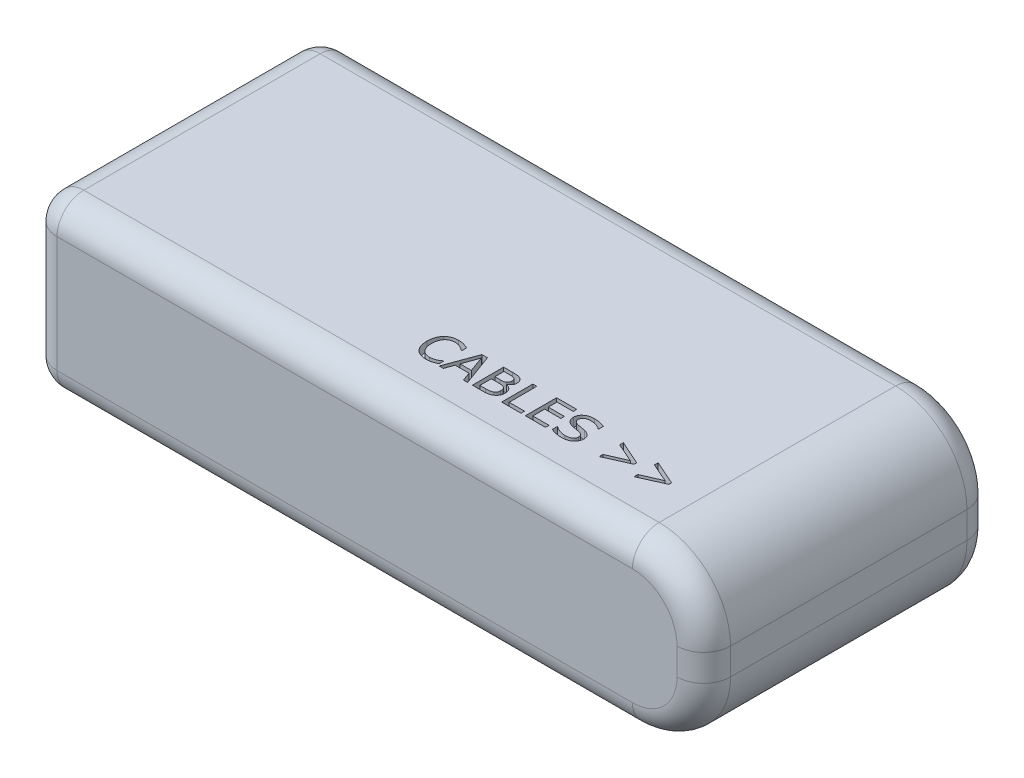
from build123d import *

# Parameters (mm, degrees)
SKETCH1_W           = 75.5
SKETCH1_H           = 32.5
BOSS_EXTRUDE1_DEPTH = 19
FILLET2_R           = 3
FILLET3_R           = 8
CUT_EXTRUDE1_DEPTH  = 1


with BuildPart() as part:
    # Sketch1 → Boss-Extrude1 (new body)
    with BuildSketch(Plane(origin=(0, 0, 0), x_dir=(1, 0, 0), z_dir=(0, 1, 0))):
        with Locations((37.75, 16.25)):
            Rectangle(SKETCH1_W, SKETCH1_H)
    extrude(amount=BOSS_EXTRUDE1_DEPTH)

    # Fillet2
    fillet2_edges = [part.edges().sort_by_distance(p)[0] for p in [
        (37.75, 19, -32.5),
        (0, 19, -16.25),
        (37.75, 0, -32.5),
        (37.75, 0, 0),
        (0, 0, -16.25),
        (37.75, 19, 0),
        (0, 9.5, -32.5),
        (75.5, 9.5, -32.5),
        (75.5, 9.5, 0),
        (0, 9.5, 0),
    ]]
    fillet(fillet2_edges, radius=FILLET2_R)

    # Fillet3
    # the kernel refuses this fillet: 8 mm, written as the material it takes off along each edge
    with BuildSketch(Plane(origin=(67.5, 11, 0), x_dir=(1, 0, 0), z_dir=(0, -1, 0))) as fillet3_piece_1:
        with BuildLine():
            CenterArc((5, -3), 3, 0, 90)
            Line((8, -3), (8, 0))
            Line((8, 0), (5, 0))
        make_face()
    revolve(axis=Axis((67.5, 11, 0), (0, 0, 1)), revolution_arc=90, mode=Mode.SUBTRACT)
    with BuildSketch(Plane(origin=(67.5, 8, 0), x_dir=(0, -1, 0), z_dir=(-1, 0, 0))) as fillet3_piece_2:
        with BuildLine():
            CenterArc((5, -3), 3, 0, 90)
            Line((8, -3), (8, 0))
            Line((8, 0), (5, 0))
        make_face()
    revolve(axis=Axis((67.5, 8, 0), (0, 0, 1)), revolution_arc=90, mode=Mode.SUBTRACT)
    with BuildSketch(Plane(origin=(67.5, 11, -32.5), x_dir=(0, 1, 0), z_dir=(-1, 0, 0))) as fillet3_piece_3:
        with BuildLine():
            CenterArc((5, -3), 3, 0, 90)
            Line((8, -3), (8, 0))
            Line((8, 0), (5, 0))
        make_face()
    revolve(axis=Axis((67.5, 11, -32.5), (0, 0, -1)), revolution_arc=90, mode=Mode.SUBTRACT)
    with BuildSketch(Plane(origin=(67.5, 8, -32.5), x_dir=(1, 0, 0), z_dir=(0, 1, 0))) as fillet3_piece_4:
        with BuildLine():
            CenterArc((5, -3), 3, 0, 90)
            Line((8, -3), (8, 0))
            Line((8, 0), (5, 0))
        make_face()
    revolve(axis=Axis((67.5, 8, -32.5), (0, 0, -1)), revolution_arc=90, mode=Mode.SUBTRACT)
    with BuildSketch(Plane(origin=(75.5, 19, 0), x_dir=(0, -1, 0), z_dir=(0, 0, -1)), Plane(origin=(75.5, 0, 0), x_dir=(-1, 0, 0), z_dir=(0, 0, -1))) as fillet3_piece_5:
        with BuildLine():
            CenterArc((FILLET3_R, FILLET3_R), FILLET3_R, 180, 90)
            Line((0, FILLET3_R), (0, 0))
            Line((0, 0), (FILLET3_R, 0))
        make_face()
    extrude(amount=32.5, mode=Mode.SUBTRACT)

    # Sketch4 → Cut-Extrude1 (cut)
    # profile 1 of 8: a face of its own
    with BuildSketch(Plane(origin=(0, 19, 0), x_dir=(1, 0, 0), z_dir=(0, 1, 0))):
        with BuildLine():
            add(Edge.make_bspline(
                [(39.761180727, 6.076453416), (39.720484477, 6.058874101), (39.64281287, 6.025322764), (39.54759346, 5.981143235), (39.471127875, 5.9477338), (39.407130772, 5.922902791), (39.335102502, 5.897295269), (39.284039435, 5.880867305), (39.257225031, 5.872240599)],
                knots=[0, 0, 0, 0, 1.466218801, 2.79837997, 3.471842409, 4.225859324, 5.068357454, 6, 6, 6, 6], degree=3))
            add(Edge.make_bspline(
                [(39.257225031, 5.872240599), (39.207968746, 5.858393861), (39.105989177, 5.829725755), (38.974333745, 5.800858137), (38.861986653, 5.783462817), (38.772376378, 5.773791359), (38.678344135, 5.768327294), (38.614365421, 5.767462218), (38.58159212, 5.76701908)],
                knots=[0, 0, 0, 0, 1.341692312, 2.777822261, 3.530957039, 4.322171559, 5.140526999, 6, 6, 6, 6], degree=3))
            add(Edge.make_bspline(
                [(38.58159212, 5.76701908), (38.519929285, 5.768355498), (38.399266194, 5.770970627), (38.222513835, 5.791243913), (38.054463539, 5.825312028), (37.894447067, 5.871624311), (37.744302339, 5.934266236), (37.603880435, 6.011629267), (37.473197124, 6.104302318), (37.395857394, 6.177921695), (37.357007468, 6.214902783)],
                knots=[0, 0, 0, 0, 1.104385245, 2.161083527, 3.181659255, 4.173014903, 5.140224961, 6.089300729, 7.040201895, 8, 8, 8, 8], degree=3))
            add(Edge.make_bspline(
                [(37.357007468, 6.214902783), (37.320701449, 6.254464099), (37.247223893, 6.334529855), (37.153765928, 6.472242323), (37.072868704, 6.624760881), (37.015867572, 6.762560162), (36.976624825, 6.879875975), (36.951082305, 6.972791905), (36.9296039, 7.069130487), (36.912500628, 7.168988599), (36.898760705, 7.272209539), (36.887970816, 7.379062773), (36.882854508, 7.489508839), (36.881911143, 7.564318859), (36.881433892, 7.602165441)],
                knots=[0, 0, 0, 0, 1.283960364, 2.59852975, 3.969994339, 5.411216797, 6.162297344, 6.930149855, 7.716785184, 8.524073837, 9.354463407, 10.209115187, 11.093986735, 12, 12, 12, 12], degree=3))
            add(Edge.make_bspline(
                [(36.881433892, 7.602165441), (36.8828038, 7.673304501), (36.885479887, 7.812273172), (36.908976941, 8.014558081), (36.945562961, 8.205706121), (36.999229255, 8.384416385), (37.066019503, 8.551411318), (37.147370594, 8.704875522), (37.241279521, 8.845840716), (37.315387058, 8.928852109), (37.35216174, 8.970045188)],
                knots=[0, 0, 0, 0, 1.151470104, 2.249372842, 3.292771279, 4.298713855, 5.265859146, 6.200122615, 7.106839577, 8, 8, 8, 8], degree=3))
            add(Edge.make_bspline(
                [(37.35216174, 8.970045188), (37.39007419, 9.007254097), (37.465942447, 9.081714468), (37.595846929, 9.176247698), (37.735849528, 9.258585569), (37.887797376, 9.325420417), (38.049262578, 9.378989403), (38.220005394, 9.416541178), (38.399101505, 9.440134264), (38.521291238, 9.442848605), (38.58366886, 9.44423427)],
                knots=[0, 0, 0, 0, 0.93877872, 1.878631025, 2.833735871, 3.807891388, 4.809756893, 5.838894108, 6.896759623, 8, 8, 8, 8], degree=3))
            add(Edge.make_bspline(
                [(38.58366886, 9.44423427), (38.630303909, 9.443409178), (38.723738151, 9.441756089), (38.863674652, 9.429152455), (39.003118048, 9.407156471), (39.144094049, 9.378162647), (39.288899642, 9.338107461), (39.440222249, 9.285653431), (39.599217053, 9.220698182), (39.706056424, 9.169515075), (39.761180727, 9.143106897)],
                knots=[0, 0, 0, 0, 0.912280266, 1.827771541, 2.74586349, 3.672824498, 4.642053622, 5.682771375, 6.804414393, 8, 8, 8, 8], degree=3))
            Line((39.761180727, 9.143106897), (39.761180727, 8.602462118))
            Line((39.761180727, 8.602462118), (39.726568385, 8.602462118))
            add(Edge.make_bspline(
                [(39.726568385, 8.602462118), (39.679577892, 8.639209573), (39.588149769, 8.710708095), (39.445289051, 8.802881474), (39.303658481, 8.880580716), (39.160608333, 8.941340487), (39.016072519, 8.988227761), (38.86739247, 9.021855015), (38.713632844, 9.041204433), (38.609334862, 9.044058817), (38.556671234, 9.045500093)],
                knots=[0, 0, 0, 0, 1.120106368, 2.179360474, 3.189882691, 4.151225788, 5.094345944, 6.040797339, 7.010731367, 8, 8, 8, 8], degree=3))
            add(Edge.make_bspline(
                [(38.556671234, 9.045500093), (38.513938496, 9.044406419), (38.430473339, 9.042270265), (38.308347941, 9.026450522), (38.193024497, 8.99837105), (38.083347617, 8.960617376), (37.980116171, 8.91011576), (37.882557252, 8.848275019), (37.790891729, 8.773488436), (37.735982204, 8.715698616), (37.707976613, 8.686223985)],
                knots=[0, 0, 0, 0, 1.077777966, 2.105105195, 3.098943798, 4.067194587, 5.025139116, 5.990709632, 6.975198523, 8, 8, 8, 8], degree=3))
            add(Edge.make_bspline(
                [(37.707976613, 8.686223985), (37.682085675, 8.654928986), (37.629273988, 8.591094231), (37.562323513, 8.482521087), (37.504513238, 8.362403449), (37.454982385, 8.230982681), (37.416826171, 8.088076367), (37.388323473, 7.934696928), (37.371765162, 7.770515209), (37.369792201, 7.65758301), (37.368775664, 7.599396454)],
                knots=[0, 0, 0, 0, 0.837152518, 1.707602665, 2.623111512, 3.584231206, 4.60047704, 5.670492373, 6.799757481, 8, 8, 8, 8], degree=3))
            add(Edge.make_bspline(
                [(37.368775664, 7.599396454), (37.369861352, 7.538884444), (37.371959594, 7.421936607), (37.391111826, 7.253202502), (37.420760567, 7.097289449), (37.463772151, 6.954794276), (37.517553515, 6.825829949), (37.577751363, 6.709022326), (37.644294638, 6.603658039), (37.696846029, 6.542459992), (37.722513797, 6.512568922)],
                knots=[0, 0, 0, 0, 1.241862862, 2.400071917, 3.481468856, 4.496024571, 5.449649898, 6.345871311, 7.192071002, 8, 8, 8, 8], degree=3))
            add(Edge.make_bspline(
                [(37.722513797, 6.512568922), (37.750023337, 6.484407008), (37.804686358, 6.428447683), (37.897476027, 6.357461433), (37.996539855, 6.297212534), (38.101965291, 6.249031496), (38.21218071, 6.211555905), (38.326121509, 6.185561708), (38.442889547, 6.16900912), (38.521772996, 6.166844075), (38.561516961, 6.165753258)],
                knots=[0, 0, 0, 0, 1.009916827, 2.006762181, 2.990523006, 3.982176514, 4.977241329, 5.97482617, 6.979653641, 8, 8, 8, 8], degree=3))
            add(Edge.make_bspline(
                [(38.561516961, 6.165753258), (38.616040555, 6.167053465), (38.723874742, 6.169624952), (38.882845745, 6.190996545), (39.036732631, 6.225566226), (39.185527427, 6.274277877), (39.329463706, 6.336851864), (39.46831612, 6.413561266), (39.602823315, 6.503498035), (39.686335735, 6.573384883), (39.728645126, 6.608791232)],
                knots=[0, 0, 0, 0, 1.024484406, 2.026176845, 3.008910844, 3.985452258, 4.964427371, 5.954398846, 6.9636495, 8, 8, 8, 8], degree=3))
            Line((39.728645126, 6.608791232), (39.761180727, 6.608791232))
            Line((39.761180727, 6.608791232), (39.761180727, 6.076453416))
        make_face()
    # profile 2 of 8: a face of its own
    with BuildSketch(Plane(origin=(0, 19, 0), x_dir=(1, 0, 0), z_dir=(0, 1, 0))):
        Polygon((43.172573132, 5.855626675), (42.700460791, 5.855626675), (42.35502962, 6.83031022), (40.800243227, 6.83031022), (40.454812056, 5.855626675), (39.982699715, 5.855626675), (41.265433101, 9.355626675), (41.889839746, 9.355626675), align=None)
        Polygon((42.209657784, 7.229044397), (41.577636423, 8.988043606), (40.943538322, 7.229044397), align=None, mode=Mode.SUBTRACT)
    # profile 3 of 8: a face of its own
    with BuildSketch(Plane(origin=(0, 19, 0), x_dir=(1, 0, 0), z_dir=(0, 1, 0))):
        with BuildLine():
            add(Edge.make_bspline(
                [(46.318142753, 6.925840283), (46.31696668, 6.883776158), (46.314680661, 6.802013009), (46.296332012, 6.683073225), (46.266139962, 6.571617523), (46.222968918, 6.468130349), (46.169107701, 6.373419926), (46.108354053, 6.285730355), (46.037518888, 6.207816113), (45.984087109, 6.163098392), (45.957482151, 6.140832372)],
                knots=[0, 0, 0, 0, 1.127205895, 2.191033432, 3.217516844, 4.215822864, 5.187970898, 6.13360162, 7.07067571, 8, 8, 8, 8], degree=3))
            add(Edge.make_bspline(
                [(45.957482151, 6.140832372), (45.924462572, 6.116418159), (45.858836209, 6.067894947), (45.753299758, 6.007020035), (45.642782045, 5.957550466), (45.52611317, 5.917923269), (45.398647511, 5.889664935), (45.257424785, 5.870269324), (45.100475322, 5.857688206), (44.990439515, 5.856334074), (44.932956835, 5.855626675)],
                knots=[0, 0, 0, 0, 0.907236661, 1.803131515, 2.686700274, 3.580326963, 4.521999058, 5.567986659, 6.72951679, 8, 8, 8, 8], degree=3))
            Line((44.932956835, 5.855626675), (43.704218702, 5.855626675))
            Line((43.704218702, 5.855626675), (43.704218702, 9.355626675))
            Line((43.704218702, 9.355626675), (44.724590537, 9.355626675))
            add(Edge.make_bspline(
                [(44.724590537, 9.355626675), (44.755049825, 9.355449093), (44.813894568, 9.355106019), (44.899046495, 9.353748023), (44.978423973, 9.351591975), (45.051838707, 9.349191089), (45.119438954, 9.344820891), (45.180828674, 9.340045009), (45.236518696, 9.33477274), (45.302702433, 9.325468864), (45.381074091, 9.310624447), (45.472353001, 9.284788372), (45.561496711, 9.251079291), (45.618719949, 9.22294786), (45.647355569, 9.208870346)],
                knots=[0, 0, 0, 0, 1.16087609, 2.242713483, 3.245606601, 4.187250078, 5.041924002, 5.827030612, 6.534080644, 7.173345571, 8.373754481, 9.570873092, 10.784417723, 12, 12, 12, 12], degree=3))
            add(Edge.make_bspline(
                [(45.647355569, 9.208870346), (45.677453637, 9.191482023), (45.735554805, 9.157915687), (45.811379384, 9.095041339), (45.874526576, 9.025574854), (45.924483582, 8.94800062), (45.961838612, 8.862995507), (45.989053395, 8.770701766), (46.004879493, 8.670383534), (46.006949113, 8.600903442), (46.00801617, 8.565080789)],
                knots=[0, 0, 0, 0, 1.067729609, 2.061140186, 3.016146581, 3.945508921, 4.886081139, 5.863125532, 6.898266949, 8, 8, 8, 8], degree=3))
            add(Edge.make_bspline(
                [(46.00801617, 8.565080789), (46.006723997, 8.524571963), (46.004219199, 8.446048082), (45.979945084, 8.332996845), (45.940653011, 8.229118235), (45.884131848, 8.135646573), (45.81503362, 8.052073725), (45.735943485, 7.976387923), (45.646187222, 7.909354834), (45.579985516, 7.872767149), (45.546287531, 7.854143289)],
                knots=[0, 0, 0, 0, 1.083450804, 2.10020309, 3.080166319, 4.044478977, 5.010492609, 5.976328372, 6.969910915, 8, 8, 8, 8], degree=3))
            Line((45.546287531, 7.854143289), (45.546287531, 7.835452625))
            add(Edge.make_bspline(
                [(45.546287531, 7.835452625), (45.575465579, 7.828936116), (45.632717204, 7.816149766), (45.715598452, 7.790311034), (45.793625203, 7.759366414), (45.867055753, 7.723076653), (45.935474236, 7.68175119), (45.999111635, 7.634851868), (46.0579267, 7.582941904), (46.111905469, 7.526197703), (46.160560106, 7.465209988), (46.203116712, 7.400013144), (46.238240867, 7.330388424), (46.267711406, 7.257051642), (46.290373997, 7.17984837), (46.306260757, 7.09850375), (46.316079023, 7.013534751), (46.317447052, 6.955402823), (46.318142753, 6.925840283)],
                knots=[0, 0, 0, 0, 1.099394393, 2.157173627, 3.189583421, 4.184138321, 5.166740929, 6.125931184, 7.088121259, 8.048737596, 9.003184014, 9.954341118, 10.907163203, 11.867066763, 12.858138352, 13.861922988, 14.91269755, 16, 16, 16, 16], degree=3))
        make_face()
        with BuildLine():
            add(Edge.make_bspline(
                [(45.520674398, 8.504163068), (45.520127987, 8.524723527), (45.519080223, 8.56414903), (45.511552027, 8.620826459), (45.498546835, 8.672515043), (45.479641564, 8.719534081), (45.455421203, 8.762126315), (45.424819849, 8.800616107), (45.387564673, 8.83443708), (45.358750467, 8.852767425), (45.344151455, 8.862054682)],
                knots=[0, 0, 0, 0, 1.174881232, 2.252881855, 3.260417971, 4.213033844, 5.140488812, 6.050815403, 7.012425702, 8, 8, 8, 8], degree=3))
            add(Edge.make_bspline(
                [(45.344151455, 8.862054682), (45.325227774, 8.872243562), (45.28661199, 8.893035055), (45.222674596, 8.915510349), (45.153305812, 8.932157257), (45.077375734, 8.941821119), (44.994427399, 8.948547271), (44.902762497, 8.953046364), (44.801923899, 8.956948022), (44.731517591, 8.956911521), (44.694823923, 8.956892498)],
                knots=[0, 0, 0, 0, 0.776481191, 1.584492397, 2.442929162, 3.353094416, 4.34992781, 5.45332361, 6.672748265, 8, 8, 8, 8], degree=3))
            Line((44.694823923, 8.956892498), (44.147256677, 8.956892498))
            Line((44.147256677, 8.956892498), (44.147256677, 7.937905156))
            Line((44.147256677, 7.937905156), (44.741204461, 7.937905156))
            add(Edge.make_bspline(
                [(44.741204461, 7.937905156), (44.775359324, 7.9381431), (44.8400053, 7.938593465), (44.931457005, 7.942632119), (45.011836423, 7.949431583), (45.082803048, 7.958605555), (45.147286755, 7.973592629), (45.207783569, 7.994262379), (45.266335132, 8.020789085), (45.302827821, 8.042970304), (45.32130731, 8.054202625)],
                knots=[0, 0, 0, 0, 1.364369286, 2.582384429, 3.655623187, 4.58639984, 5.438292603, 6.295306664, 7.136762368, 8, 8, 8, 8], degree=3))
            add(Edge.make_bspline(
                [(45.32130731, 8.054202625), (45.338577182, 8.066377617), (45.37228117, 8.090138406), (45.415037599, 8.134100664), (45.450370565, 8.182853828), (45.476345468, 8.237890214), (45.496494279, 8.29740777), (45.510962724, 8.361894208), (45.519164002, 8.43149417), (45.520160767, 8.479451029), (45.520674398, 8.504163068)],
                knots=[0, 0, 0, 0, 0.982653958, 1.917753487, 2.842599081, 3.775409047, 4.740976195, 5.766003215, 6.848827512, 8, 8, 8, 8], degree=3))
        make_face(mode=Mode.SUBTRACT)
        with BuildLine():
            add(Edge.make_bspline(
                [(45.83080098, 6.905765125), (45.83001298, 6.938795584), (45.828514068, 7.001625168), (45.817151909, 7.090638417), (45.797310416, 7.168850926), (45.76928328, 7.237951789), (45.729999731, 7.2992588), (45.678302659, 7.354515009), (45.613758552, 7.404847066), (45.564037109, 7.432118368), (45.537980569, 7.446409903)],
                knots=[0, 0, 0, 0, 1.209028866, 2.299779717, 3.27707966, 4.155600412, 5.017930191, 5.92655662, 6.913411272, 8, 8, 8, 8], degree=3))
            add(Edge.make_bspline(
                [(45.537980569, 7.446409903), (45.518542493, 7.455610948), (45.478440372, 7.474593353), (45.412782485, 7.495462311), (45.341323782, 7.512338069), (45.26313986, 7.522728582), (45.177879907, 7.530063572), (45.084628081, 7.535760777), (44.982809253, 7.53804203), (44.912189694, 7.538784987), (44.875500347, 7.539170979)],
                knots=[0, 0, 0, 0, 0.764129362, 1.576452719, 2.444414057, 3.372925737, 4.378236626, 5.488120053, 6.694989922, 8, 8, 8, 8], degree=3))
            Line((44.875500347, 7.539170979), (44.147256677, 7.539170979))
            Line((44.147256677, 7.539170979), (44.147256677, 6.254360853))
            Line((44.147256677, 6.254360853), (44.760587373, 6.254360853))
            add(Edge.make_bspline(
                [(44.760587373, 6.254360853), (44.809049782, 6.254787522), (44.901393504, 6.255600529), (45.033017793, 6.26088587), (45.150851268, 6.270267145), (45.255809229, 6.283982136), (45.350103619, 6.302116116), (45.434597861, 6.327919927), (45.511260293, 6.358891075), (45.556309896, 6.386871744), (45.578130885, 6.400424935)],
                knots=[0, 0, 0, 0, 1.382036399, 2.633430506, 3.755894759, 4.751698186, 5.651200793, 6.490124839, 7.268651261, 8, 8, 8, 8], degree=3))
            add(Edge.make_bspline(
                [(45.578130885, 6.400424935), (45.598762927, 6.415710125), (45.638817138, 6.445384176), (45.691941871, 6.49543369), (45.735906095, 6.548966076), (45.771607363, 6.606543888), (45.799306847, 6.670025543), (45.817142905, 6.741610975), (45.829487627, 6.820883562), (45.830350283, 6.876636713), (45.83080098, 6.905765125)],
                knots=[0, 0, 0, 0, 1.039919986, 2.01885861, 2.949160518, 3.839259393, 4.756451469, 5.743085955, 6.820868054, 8, 8, 8, 8], degree=3))
        make_face(mode=Mode.SUBTRACT)
    # profile 4 of 8: a face of its own
    with BuildSketch(Plane(origin=(0, 19, 0), x_dir=(1, 0, 0), z_dir=(0, 1, 0))):
        Polygon((49.153585791, 5.855626675), (46.982699715, 5.855626675), (46.982699715, 9.355626675), (47.425737689, 9.355626675), (47.425737689, 6.254360853), (49.153585791, 6.254360853), align=None)
    # profile 5 of 8: a face of its own
    with BuildSketch(Plane(origin=(0, 19, 0), x_dir=(1, 0, 0), z_dir=(0, 1, 0))):
        Polygon((51.900421234, 5.855626675), (49.640927563, 5.855626675), (49.640927563, 9.355626675), (51.900421234, 9.355626675), (51.900421234, 8.956892498), (50.083965537, 8.956892498), (50.083965537, 7.982208954), (51.900421234, 7.982208954), (51.900421234, 7.583474777), (50.083965537, 7.583474777), (50.083965537, 6.254360853), (51.900421234, 6.254360853), align=None)
    # profile 6 of 8: a face of its own
    with BuildSketch(Plane(origin=(0, 19, 0), x_dir=(1, 0, 0), z_dir=(0, 1, 0))):
        with BuildLine():
            add(Edge.make_bspline(
                [(55.178902246, 6.844155156), (55.177563045, 6.809712638), (55.17487724, 6.740637226), (55.157316767, 6.637049814), (55.12612963, 6.534581729), (55.084872485, 6.433446554), (55.03385624, 6.335894813), (54.970349411, 6.246517718), (54.899602362, 6.162664576), (54.844088659, 6.114977506), (54.816164904, 6.090990599)],
                knots=[0, 0, 0, 0, 0.958238547, 1.921773581, 2.912947071, 3.932182148, 4.957403707, 5.967133515, 6.977454923, 8, 8, 8, 8], degree=3))
            add(Edge.make_bspline(
                [(54.816164904, 6.090990599), (54.783818936, 6.066392492), (54.71882148, 6.01696394), (54.612393003, 5.952949119), (54.498129819, 5.898092637), (54.375859136, 5.850041079), (54.242851092, 5.812525826), (54.097812402, 5.785921668), (53.939901112, 5.7700765), (53.830443363, 5.768063638), (53.77364117, 5.76701908)],
                knots=[0, 0, 0, 0, 0.875010101, 1.758285011, 2.669883311, 3.603235951, 4.585195802, 5.642137874, 6.77640697, 8, 8, 8, 8], degree=3))
            add(Edge.make_bspline(
                [(53.77364117, 5.76701908), (53.712004657, 5.767704253), (53.591813826, 5.769040335), (53.416216738, 5.782681653), (53.250224986, 5.803647383), (53.092072162, 5.83370309), (52.938484014, 5.873576771), (52.785218945, 5.920717948), (52.630101956, 5.975023041), (52.528075424, 6.017989745), (52.476370601, 6.039764334)],
                knots=[0, 0, 0, 0, 1.10716707, 2.158969148, 3.162189912, 4.111841624, 5.048950327, 6.011490534, 6.992266746, 8, 8, 8, 8], degree=3))
            Line((52.476370601, 6.039764334), (52.476370601, 6.608791232))
            Line((52.476370601, 6.608791232), (52.509598449, 6.608791232))
            add(Edge.make_bspline(
                [(52.509598449, 6.608791232), (52.554869389, 6.574384331), (52.645893698, 6.505203875), (52.795521652, 6.417926138), (52.954341772, 6.341158311), (53.121814062, 6.278958061), (53.291073898, 6.22848679), (53.45789642, 6.193759934), (53.619024073, 6.169542576), (53.725100333, 6.166999807), (53.777102404, 6.165753258)],
                knots=[0, 0, 0, 0, 0.998277588, 2.007193266, 3.037199156, 4.09444581, 5.142581095, 6.137353469, 7.086869412, 8, 8, 8, 8], degree=3))
            add(Edge.make_bspline(
                [(53.777102404, 6.165753258), (53.812188506, 6.166321483), (53.880369301, 6.167425682), (53.97980531, 6.174912761), (54.073168789, 6.188110778), (54.160743698, 6.205744863), (54.242260874, 6.229340603), (54.31773247, 6.258357245), (54.387346463, 6.292235395), (54.450669982, 6.331138944), (54.507374184, 6.37421237), (54.555995026, 6.421931672), (54.59846549, 6.471871228), (54.63241811, 6.526305424), (54.65911257, 6.584208549), (54.677494391, 6.64576769), (54.690068328, 6.710502352), (54.691056958, 6.75502417), (54.691560474, 6.77769946)],
                knots=[0, 0, 0, 0, 1.366642471, 2.655717346, 3.88104988, 5.037391712, 6.132484954, 7.182384549, 8.183281467, 9.143647958, 10.073065321, 10.950208906, 11.792587189, 12.62050442, 13.440972499, 14.268304077, 15.118034511, 16, 16, 16, 16], degree=3))
            add(Edge.make_bspline(
                [(54.691560474, 6.77769946), (54.691052948, 6.796628388), (54.690067198, 6.833393405), (54.685597667, 6.886685882), (54.676691229, 6.936346312), (54.663273795, 6.981776795), (54.647840451, 7.023964569), (54.627265621, 7.061549012), (54.603965916, 7.095776983), (54.566446619, 7.136454412), (54.509991681, 7.182034467), (54.428736545, 7.228117186), (54.333484492, 7.269368783), (54.263350636, 7.289198043), (54.226370601, 7.299653574)],
                knots=[0, 0, 0, 0, 0.884191376, 1.717335091, 2.495122358, 3.235195947, 3.927607665, 4.588092065, 5.230755958, 5.856298597, 7.165657462, 8.599826319, 10.207163441, 12, 12, 12, 12], degree=3))
            add(Edge.make_bspline(
                [(54.226370601, 7.299653574), (54.164717298, 7.315103048), (54.03716167, 7.347066743), (53.835740861, 7.37844905), (53.621437727, 7.412545037), (53.475194004, 7.441745343), (53.399827879, 7.456793606)],
                knots=[0, 0, 0, 0, 0.905774826, 1.873973858, 2.904360819, 4, 4, 4, 4], degree=3))
            add(Edge.make_bspline(
                [(53.399827879, 7.456793606), (53.36187, 7.465339395), (53.287721849, 7.482033018), (53.181444852, 7.513967053), (53.08268941, 7.549914587), (52.991400648, 7.590070134), (52.907719597, 7.634784311), (52.831507047, 7.684327572), (52.762871484, 7.73802346), (52.702011744, 7.796845506), (52.648532736, 7.85983349), (52.602446869, 7.927642778), (52.563499649, 8.000029581), (52.531729359, 8.077099779), (52.506688903, 8.158669001), (52.488720785, 8.244604839), (52.47827628, 8.335225687), (52.477015596, 8.397068154), (52.476370601, 8.428708163)],
                knots=[0, 0, 0, 0, 1.266244872, 2.473523748, 3.609430491, 4.685573945, 5.717309747, 6.694444435, 7.641165838, 8.549564578, 9.444982174, 10.326267815, 11.213519473, 12.116060731, 13.035571795, 13.987256657, 14.970234833, 16, 16, 16, 16], degree=3))
            add(Edge.make_bspline(
                [(52.476370601, 8.428708163), (52.477258748, 8.465022934), (52.479006982, 8.536505071), (52.498093613, 8.640914614), (52.526651854, 8.740950769), (52.568787408, 8.835335927), (52.621860215, 8.924865738), (52.686873514, 9.009285158), (52.764124814, 9.088060649), (52.852269379, 9.161200932), (52.94873828, 9.227744355), (53.052988749, 9.285533391), (53.163187223, 9.334775276), (53.279971269, 9.37489884), (53.40292985, 9.406107642), (53.532366464, 9.427800811), (53.667857432, 9.442336322), (53.76044927, 9.44359423), (53.807561265, 9.44423427)],
                knots=[0, 0, 0, 0, 0.93186373, 1.834284152, 2.717757153, 3.598900374, 4.481318766, 5.385955915, 6.329138546, 7.309728411, 8.324222123, 9.335246284, 10.367457551, 11.420996846, 12.503585911, 13.622345141, 14.790216649, 16, 16, 16, 16], degree=3))
            add(Edge.make_bspline(
                [(53.807561265, 9.44423427), (53.868503785, 9.443516397), (53.98822903, 9.442106091), (54.163867757, 9.428681869), (54.331968434, 9.406916832), (54.491656903, 9.37534705), (54.642995127, 9.337883723), (54.785747144, 9.29642181), (54.919744565, 9.251257985), (55.004627576, 9.216242062), (55.045990854, 9.199178891)],
                knots=[0, 0, 0, 0, 1.150507957, 2.260242094, 3.323779993, 4.349133371, 5.331863596, 6.266671458, 7.155353347, 8, 8, 8, 8], degree=3))
            Line((55.045990854, 9.199178891), (55.045990854, 8.646765916))
            Line((55.045990854, 8.646765916), (55.012763006, 8.646765916))
            add(Edge.make_bspline(
                [(55.012763006, 8.646765916), (54.976902601, 8.6750804), (54.902830024, 8.733566267), (54.775653645, 8.807540651), (54.63369252, 8.875229155), (54.478039999, 8.934363926), (54.314263725, 8.984130488), (54.145610387, 9.01922624), (53.975233834, 9.041697529), (53.86070283, 9.044232136), (53.803407784, 9.045500093)],
                knots=[0, 0, 0, 0, 0.844883944, 1.745176377, 2.715723749, 3.754103651, 4.824376165, 5.880759087, 6.939832863, 8, 8, 8, 8], degree=3))
            add(Edge.make_bspline(
                [(53.803407784, 9.045500093), (53.772476213, 9.044868592), (53.712151252, 9.043636992), (53.624016284, 9.036963957), (53.540654912, 9.024738544), (53.462228133, 9.006236406), (53.387827866, 8.984708825), (53.318439048, 8.956789939), (53.253651467, 8.924046567), (53.193591775, 8.887129363), (53.140045688, 8.845774936), (53.092703841, 8.801911948), (53.053211458, 8.754540951), (53.019937088, 8.704482731), (52.995263508, 8.6508105), (52.976940719, 8.594649694), (52.965452644, 8.535550981), (52.964298264, 8.494985132), (52.963712373, 8.474396454)],
                knots=[0, 0, 0, 0, 1.312243396, 2.559230812, 3.746991905, 4.88199382, 5.975198927, 7.029452753, 8.049431469, 9.051737649, 10.014997771, 10.915220619, 11.783753603, 12.625393945, 13.457416532, 14.280815092, 15.127449702, 16, 16, 16, 16], degree=3))
            add(Edge.make_bspline(
                [(52.963712373, 8.474396454), (52.964848697, 8.439430456), (52.967025103, 8.372459967), (52.988724322, 8.277947406), (53.024111007, 8.194820517), (53.066581504, 8.135278588), (53.108708016, 8.094457296), (53.145489445, 8.065330643), (53.188020675, 8.038381618), (53.235840485, 8.013641338), (53.288930454, 7.990862263), (53.347066667, 7.969312223), (53.410979198, 7.950114013), (53.455621785, 7.938878673), (53.478744018, 7.933059428)],
                knots=[0, 0, 0, 0, 1.521711243, 2.914538464, 4.197948905, 5.437025414, 6.069885123, 6.749879978, 7.477917117, 8.26050625, 9.093660275, 9.994009443, 10.961014926, 12, 12, 12, 12], degree=3))
            add(Edge.make_bspline(
                [(53.478744018, 7.933059428), (53.506883827, 7.927233209), (53.568171106, 7.914543955), (53.668328493, 7.895195891), (53.784130315, 7.873746382), (53.911856019, 7.851818477), (54.042265219, 7.829734903), (54.166417448, 7.805389664), (54.279753936, 7.780715776), (54.351473399, 7.762923021), (54.385587373, 7.754459745)],
                knots=[0, 0, 0, 0, 0.746018353, 1.624795485, 2.648176751, 3.803397189, 4.989153301, 6.081745021, 7.087565693, 8, 8, 8, 8], degree=3))
            add(Edge.make_bspline(
                [(54.385587373, 7.754459745), (54.417541748, 7.74559293), (54.47988111, 7.72829478), (54.569478092, 7.696834075), (54.653254075, 7.662437713), (54.730962085, 7.62466579), (54.801815635, 7.582597418), (54.867564812, 7.538445455), (54.926847697, 7.490205516), (54.980101712, 7.438315106), (55.028023195, 7.382974541), (55.068034074, 7.321092854), (55.103010077, 7.254824601), (55.130365404, 7.182567838), (55.153025651, 7.105633123), (55.16738317, 7.02293277), (55.177861634, 6.935338386), (55.178548977, 6.875110227), (55.178902246, 6.844155156)],
                knots=[0, 0, 0, 0, 1.202646595, 2.346227069, 3.442097422, 4.486508477, 5.477037378, 6.428899289, 7.357059673, 8.244943127, 9.123784923, 10.005968637, 10.911974029, 11.836844998, 12.80378692, 13.816731742, 14.877879993, 16, 16, 16, 16], degree=3))
        make_face()
    # profile 7 of 8: a face of its own
    with BuildSketch(Plane(origin=(0, 19, 0), x_dir=(1, 0, 0), z_dir=(0, 1, 0))):
        Polygon((60.451054145, 7.238735853), (57.748522499, 6.032841865), (57.748522499, 6.455804682), (59.879950506, 7.384107688), (57.748522499, 8.312410694), (57.748522499, 8.735373511), (60.451054145, 7.529479523), align=None)
    # profile 8 of 8: a face of its own
    with BuildSketch(Plane(origin=(0, 19, 0), x_dir=(1, 0, 0), z_dir=(0, 1, 0))):
        Polygon((64.349788322, 7.238735853), (61.647256677, 6.032841865), (61.647256677, 6.455804682), (63.778684683, 7.384107688), (61.647256677, 8.312410694), (61.647256677, 8.735373511), (64.349788322, 7.529479523), align=None)
    extrude(amount=-CUT_EXTRUDE1_DEPTH, mode=Mode.SUBTRACT)


solid = part.part
